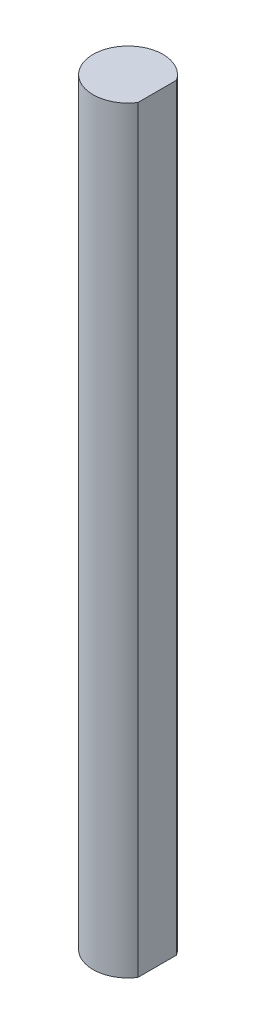
from build123d import *

# Parameters (mm, degrees)
BOSS_EXTRUDE1_DEPTH = 65


with BuildPart() as part:
    # Sketch1 → Boss-Extrude1 (new body)
    with BuildSketch(Plane(origin=(0, 0, 0), x_dir=(1, 0, 0), z_dir=(0, 1, 0))):
        with BuildLine():
            ThreePointArc((2.5, 1.658312395), (-3, 0), (2.5, -1.658312395))
            Line((2.5, -1.658312395), (2.5, 1.658312395))
        make_face()
    extrude(amount=BOSS_EXTRUDE1_DEPTH)


solid = part.part
